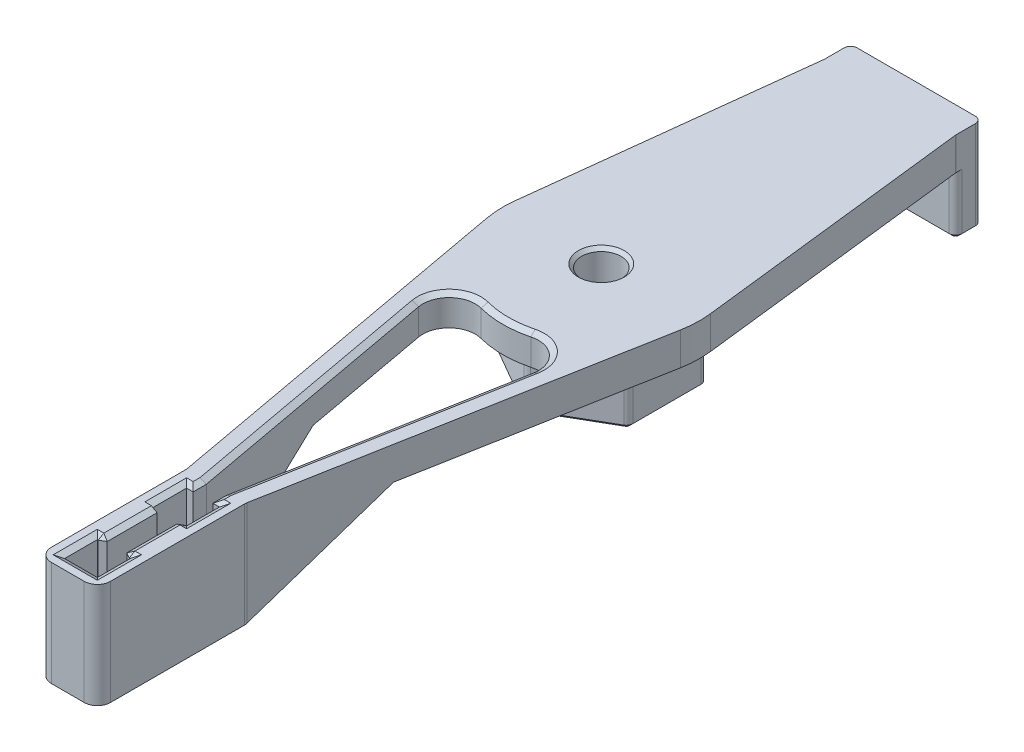
from build123d import *
from OCP.BRepFilletAPI import BRepFilletAPI_MakeChamfer

# Parameters (mm, degrees)
SKETCH1_R           = 15
BOSS_EXTRUDE1_DEPTH = 5
BOSS_EXTRUDE2_DEPTH = 9
CUT_EXTRUDE1_REACH  = 27.417
SKETCH3_R           = 3
FILLET1_R           = 1
CHAMFER1_SIZE       = 0.5
BOSS_EXTRUDE3_START = -5
BOSS_EXTRUDE3_DEPTH = 5
SKETCH5_W           = 20
SKETCH5_H           = 4
BOSS_EXTRUDE4_DEPTH = 9
FILLET2_R           = 1
CHAMFER3_SIZE       = 0.5
FILLET3_R           = 1
BOSS_EXTRUDE5_START = -5
BOSS_EXTRUDE5_DEPTH = 5
SKETCH7_W           = 9
SKETCH7_H           = 22.6
BOSS_EXTRUDE6_DEPTH = 11
SKETCH8_W           = 5
SKETCH8_H           = 18.6
CUT_EXTRUDE2_DEPTH  = 3
CUT_EXTRUDE4_REACH  = 85.688
SKETCH10_W          = 5
SKETCH10_H          = 5
CUT_EXTRUDE5_DEPTH  = 16
CHAMFER5_SIZE       = 19.052558883
CHAMFER5_SIZE_2     = 11
FILLET4_R           = 4
CHAMFER6_SIZE       = 0.5
CHAMFER6_SIZE2      = 0.866025404
FILLET5_R           = 2


with BuildPart() as part:
    # Sketch1 → Boss-Extrude1 (new body)
    with BuildSketch(Plane(origin=(0, 0, 0), x_dir=(1, 0, 0), z_dir=(0, 1, 0))):
        with Locations(Location((0, 0, 0), (0, 0, 270))):
            Circle(SKETCH1_R)
    extrude(amount=BOSS_EXTRUDE1_DEPTH)

    # Sketch2 → Boss-Extrude2 (add)
    with BuildSketch(Plane.XZ):
        Polygon((0, 11.547005384), (-10, 5.773502692), (-10, -5.773502692), (0, -11.547005384), (10, -5.773502692), (10, 5.773502692), align=None)
    extrude(amount=BOSS_EXTRUDE2_DEPTH)

    # Sketch3 → Cut-Extrude1 (cut, up to next)
    with BuildSketch(Plane(origin=(0, 5, 0), x_dir=(1, 0, 0), z_dir=(0, 1, 0)), mode=Mode.PRIVATE) as cut_extrude1_sk1:
        with Locations(Location((0, 0, 0), (0, 0, 270))):
            Circle(SKETCH3_R)
    cut_extrude1_tool1 = extrude(cut_extrude1_sk1.sketch, amount=-CUT_EXTRUDE1_REACH, mode=Mode.PRIVATE) & part.part
    add(cut_extrude1_tool1.solids().sort_by_distance((0, 5, 0))[0], mode=Mode.SUBTRACT)

    # Fillet1
    fillet1_edges = [part.edges().sort_by_distance(p)[0] for p in [
        (10, -4.5, 5.773502692),
        (0, -4.5, 11.547005384),
        (-10, -4.5, 5.773502692),
        (-10, -4.5, -5.773502692),
        (0, -4.5, -11.547005384),
        (10, -4.5, -5.773502692),
    ]]
    fillet(fillet1_edges, radius=FILLET1_R)

    # Chamfer1
    chamfer1_edges = [part.edges().sort_by_distance(p)[0] for p in [
        (0, -9, -3),
        (0, 5, -3),
        (-5, 0, -8.660254038),
        (-5, -9, -8.660254038),
        (-10, 0, 0),
        (-10, -9, 0),
        (5, -9, 8.660254038),
        (-5, -9, 8.660254038),
        (5, -9, -8.660254038),
        (10, -9, 0),
        (-9.866025404, -9, 5.696152423),
        (0, -9, 11.392304845),
        (9.866025404, -9, 5.696152423),
        (9.866025404, -9, -5.696152423),
        (0, -9, -11.392304845),
        (-9.866025404, -9, -5.696152423),
        (5, 0, -8.660254038),
        (10, 0, 0),
        (5, 0, 8.660254038),
        (-5, 0, 8.660254038),
        (-9.866025404, 0, -5.696152423),
        (0, 0, -11.392304845),
        (9.866025404, 0, -5.696152423),
        (9.866025404, 0, 5.696152423),
        (0, 0, 11.392304845),
        (-9.866025404, 0, 5.696152423),
    ]]
    chamfer(chamfer1_edges, length=CHAMFER1_SIZE)

    # Sketch4 → Boss-Extrude3 (add)
    with BuildSketch(Plane(origin=(0, 5, 0), x_dir=(1, 0, 0), z_dir=(0, 1, 0)).offset(BOSS_EXTRUDE3_START)):
        with BuildLine():
            Line((10, 48), (-10, 48))
            Line((-10, 48), (-10, 44))
            Line((-10, 44), (-14.900225018, 1.727221587))
            ThreePointArc((-14.900225018, 1.727221587), (0, 15), (14.900225018, 1.727221587))
            Line((14.900225018, 1.727221587), (10, 44))
            Line((10, 44), (10, 48))
        make_face()
    extrude(amount=BOSS_EXTRUDE3_DEPTH)

    # Sketch5 → Boss-Extrude4 (add)
    with BuildSketch(Plane.XZ):
        with Locations((0, -46)):
            Rectangle(SKETCH5_W, SKETCH5_H)
    extrude(amount=BOSS_EXTRUDE4_DEPTH)

    # Fillet2
    fillet2_edges = [part.edges().sort_by_distance(p)[0] for p in [
        (-10, -2, -48),
        (10, -2, -48),
        (-10, -4.5, -44),
        (10, -4.5, -44),
    ]]
    fillet(fillet2_edges, radius=FILLET2_R)

    # Chamfer3
    chamfer3_edges = [part.edges().sort_by_distance(p)[0] for p in [
        (-10, -9, -46),
        (0, -9, -44),
        (0, -9, -48),
        (10, -9, -46),
        (-9.707106781, -9, -47.707106781),
        (9.707106781, -9, -47.707106781),
        (9.707106781, -9, -44.292893219),
        (-9.707106781, -9, -44.292893219),
    ]]
    chamfer(chamfer3_edges, length=CHAMFER3_SIZE)

    # Fillet3
    fillet3_edges = [part.edges().sort_by_distance(p)[0] for p in [
        (-10, 2.5, -44),
        (10, 2.5, -44),
    ]]
    fillet(fillet3_edges, radius=FILLET3_R)

    # Sketch6 → Boss-Extrude5 (add)
    with BuildSketch(Plane(origin=(0, 5, 0), x_dir=(1, 0, 0), z_dir=(0, 1, 0)).offset(BOSS_EXTRUDE5_START)):
        with BuildLine():
            Line((4.5, -58.7), (4.5, -81.3))
            Line((4.5, -81.3), (-4.5, -81.3))
            Line((-4.5, -81.3), (-4.5, -58.7))
            Line((-4.5, -58.7), (-14.754643314, -2.701943869))
            ThreePointArc((-14.754643314, -2.701943869), (0, -15), (14.754643314, -2.701943869))
            Line((14.754643314, -2.701943869), (4.5, -58.7))
        make_face()
    extrude(amount=BOSS_EXTRUDE5_DEPTH)

    # Sketch7 → Boss-Extrude6 (add)
    with BuildSketch(Plane.XZ):
        with Locations((0, 70)):
            Rectangle(SKETCH7_W, SKETCH7_H)
    extrude(amount=BOSS_EXTRUDE6_DEPTH)

    # Sketch8 → Cut-Extrude2 (cut)
    with BuildSketch(Plane.XZ.offset(11)):
        with Locations((0, 70)):
            Rectangle(SKETCH8_W, SKETCH8_H)
    extrude(amount=-CUT_EXTRUDE2_DEPTH, mode=Mode.SUBTRACT)

    # Sketch10 → Cut-Extrude4 (cut, up to next)
    with BuildSketch(Plane.XZ.offset(8), mode=Mode.PRIVATE) as cut_extrude4_sk1:
        with Locations((0, 76.8)):
            Rectangle(SKETCH10_W, SKETCH10_H)
    cut_extrude4_tool1 = extrude(cut_extrude4_sk1.sketch, amount=-CUT_EXTRUDE4_REACH, mode=Mode.PRIVATE) & part.part
    # Sketch10 → Cut-Extrude4 (cut, up to next)
    with BuildSketch(Plane.XZ.offset(8), mode=Mode.PRIVATE) as cut_extrude4_sk2:
        with Locations((0, 63.2)):
            Rectangle(SKETCH10_W, SKETCH10_H)
    cut_extrude4_tool2 = extrude(cut_extrude4_sk2.sketch, amount=-CUT_EXTRUDE4_REACH, mode=Mode.PRIVATE) & part.part
    add(cut_extrude4_tool1.solids().sort_by_distance((0, -8, 76.8))[0], mode=Mode.SUBTRACT)
    add(cut_extrude4_tool2.solids().sort_by_distance((0, -8, 63.2))[0], mode=Mode.SUBTRACT)

    # Sketch11 → Cut-Extrude5 (cut)
    with BuildSketch(Plane.XZ.offset(11)):
        with BuildLine():
            Line((-1.5, 74.3), (-1.5, 58.7))
            Line((-1.5, 58.7), (-10.24267003, 10.958453844))
            ThreePointArc((-10.24267003, 10.958453844), (0, 15), (10.24267003, 10.958453844))
            Line((10.24267003, 10.958453844), (1.5, 58.7))
            Line((1.5, 58.7), (1.5, 74.3))
            Line((1.5, 74.3), (-1.5, 74.3))
        make_face()
    extrude(amount=-CUT_EXTRUDE5_DEPTH, mode=Mode.SUBTRACT)

    # Chamfer5
    # the kernel refuses this chamfer: 19.052558883, 11 mm, written as the material it adds along each edge
    with BuildSketch(Plane(origin=(47.790603676, 0, 58.7), x_dir=(0, 0.01932676561270063, -0.9998132206222079), z_dir=(-1, 0, 0))) as chamfer5_piece_1_section:
        Polygon((CHAMFER5_SIZE * 0.999813220636, CHAMFER5_SIZE * 0.019326765613), (-CHAMFER5_SIZE_2 * 0.0193267656127, CHAMFER5_SIZE_2 * 0.999813220622), (0, 0), align=None)
    chamfer5_piece_1 = extrude(amount=101.581207353, mode=Mode.PRIVATE)
    chamfer5_piece_1 = split(chamfer5_piece_1, bisect_by=Plane(origin=(6.212258684, -2.756527894, 49.349781279), z_dir=(-0.9836428876173074, 0, -0.18012959123887753)), keep=Keep.TOP, mode=Mode.PRIVATE)
    chamfer5_piece_1 = split(chamfer5_piece_1, bisect_by=Plane(origin=(3.309598693, -2.756527894, 48.818231705), z_dir=(0.9836428876173074, 0, 0.18012959123887784)), keep=Keep.TOP, mode=Mode.PRIVATE)
    add(chamfer5_piece_1)
    with BuildSketch(Plane(origin=(47.790603676, 0, 58.7), x_dir=(0, 0.01932676561270063, -0.9998132206222079), z_dir=(-1, 0, 0))) as chamfer5_piece_2_section:
        Polygon((CHAMFER5_SIZE * 0.999813220636, CHAMFER5_SIZE * 0.019326765613), (-CHAMFER5_SIZE_2 * 0.0193267656127, CHAMFER5_SIZE_2 * 0.999813220622), (0, 0), align=None)
    chamfer5_piece_2 = extrude(amount=101.581207353, mode=Mode.PRIVATE)
    chamfer5_piece_2 = split(chamfer5_piece_2, bisect_by=Plane(origin=(-2.334821756, -4.240286921, 54.141246068), z_dir=(-0.9836428876173074, 0, 0.18012959123887784)), keep=Keep.TOP, mode=Mode.PRIVATE)
    chamfer5_piece_2 = split(chamfer5_piece_2, bisect_by=Plane(origin=(-5.237481747, -4.240286921, 54.672795642), z_dir=(0.9836428876173074, 0, -0.18012959123887773)), keep=Keep.TOP, mode=Mode.PRIVATE)
    add(chamfer5_piece_2)
    with BuildSketch(Plane(origin=(53.790603676, 0, 58.7), x_dir=(0, 0.01932676561270063, -0.9998132206222079), z_dir=(-1, 0, 0))) as chamfer5_piece_3_section:
        Polygon((CHAMFER5_SIZE * 0.999813220636, CHAMFER5_SIZE * 0.019326765613), (-CHAMFER5_SIZE_2 * 0.0193267656127, CHAMFER5_SIZE_2 * 0.999813220622), (0, 0), align=None)
    chamfer5_piece_3 = extrude(amount=101.581207353, mode=Mode.PRIVATE)
    chamfer5_piece_3 = split(chamfer5_piece_3, bisect_by=Plane(origin=(6.212258684, -2.756527894, 49.349781279), z_dir=(-0.9836428876173074, 0, -0.18012959123887753)), keep=Keep.TOP, mode=Mode.PRIVATE)
    chamfer5_piece_3 = split(chamfer5_piece_3, bisect_by=Plane(origin=(3.309598693, -2.756527894, 48.818231705), z_dir=(0.9836428876173074, 0, 0.18012959123887784)), keep=Keep.TOP, mode=Mode.PRIVATE)
    add(chamfer5_piece_3)
    with BuildSketch(Plane(origin=(53.790603676, 0, 58.7), x_dir=(0, 0.01932676561270063, -0.9998132206222079), z_dir=(-1, 0, 0))) as chamfer5_piece_4_section:
        Polygon((CHAMFER5_SIZE * 0.999813220636, CHAMFER5_SIZE * 0.019326765613), (-CHAMFER5_SIZE_2 * 0.0193267656127, CHAMFER5_SIZE_2 * 0.999813220622), (0, 0), align=None)
    chamfer5_piece_4 = extrude(amount=101.581207353, mode=Mode.PRIVATE)
    chamfer5_piece_4 = split(chamfer5_piece_4, bisect_by=Plane(origin=(-2.334821756, -4.240286921, 54.141246068), z_dir=(-0.9836428876173074, 0, 0.18012959123887784)), keep=Keep.TOP, mode=Mode.PRIVATE)
    chamfer5_piece_4 = split(chamfer5_piece_4, bisect_by=Plane(origin=(-5.237481747, -4.240286921, 54.672795642), z_dir=(0.9836428876173074, 0, -0.18012959123887773)), keep=Keep.TOP, mode=Mode.PRIVATE)
    add(chamfer5_piece_4)

    # Fillet4
    fillet4_edges = [part.edges().sort_by_distance(p)[0] for p in [
        (10.24267003, 2.5, 10.958453844),
        (-10.24267003, 2.5, 10.958453844),
    ]]
    fillet(fillet4_edges, radius=FILLET4_R)

    # Chamfer6: one chamfer whose edges measure the first distance from different faces: ONE call of the kernel's chamfer builder (chamfer() names one face for all edges)
    chamfer6_edges_1 = [part.edges().sort_by_distance(p)[0] for p in [
        (0, -11, 79.3),
        (-2.5, -11, 70),
        (-2, -11, 60.7),
        (2.5, -11, 70),
        (2, -11, 60.7),
        (-1.5, -11, 59.7),
        (1.5, -11, 59.7),
    ]]
    chamfer6_side_1 = [part.faces().sort_by_distance(p)[0] for p in [
        (-4.256738823, -11, 70),
    ]]
    chamfer6_edges_2 = [part.edges().sort_by_distance(p)[0] for p in [
        (-2.5, 5, 76.8),
        (-2.5, 5, 63.2),
    ]]
    chamfer6_side_2 = [part.faces().sort_by_distance(p)[0] for p in [
        (-2.5, -3, 79.054651269),
    ]]
    chamfer6_edges_3 = [part.edges().sort_by_distance(p)[0] for p in [
        (0, 5, 79.3),
    ]]
    chamfer6_side_3 = [part.faces().sort_by_distance(p)[0] for p in [
        (0, -3, 79.3),
    ]]
    chamfer6_edges_4 = [part.edges().sort_by_distance(p)[0] for p in [
        (2.5, 5, 76.8),
        (2.5, 5, 63.2),
    ]]
    chamfer6_side_4 = [part.faces().sort_by_distance(p)[0] for p in [
        (2.5, -1.5, 74.545348731),
    ]]
    chamfer6_edges_5 = [part.edges().sort_by_distance(p)[0] for p in [
        (-2, 5, 74.3),
    ]]
    chamfer6_side_5 = [part.faces().sort_by_distance(p)[0] for p in [
        (-2, -1.5, 74.3),
    ]]
    chamfer6_edges_6 = [part.edges().sort_by_distance(p)[0] for p in [
        (-2, 5, 60.7),
    ]]
    chamfer6_side_6 = [part.faces().sort_by_distance(p)[0] for p in [
        (-2, -3, 60.7),
    ]]
    chamfer6_edges_7 = [part.edges().sort_by_distance(p)[0] for p in [
        (2, 5, 65.7),
    ]]
    chamfer6_side_7 = [part.faces().sort_by_distance(p)[0] for p in [
        (2, -1.5, 65.7),
    ]]
    chamfer6_edges_8 = [part.edges().sort_by_distance(p)[0] for p in [
        (2, 5, 74.3),
    ]]
    chamfer6_side_8 = [part.faces().sort_by_distance(p)[0] for p in [
        (2, -1.5, 74.3),
    ]]
    chamfer6_edges_9 = [part.edges().sort_by_distance(p)[0] for p in [
        (-2, 5, 65.7),
    ]]
    chamfer6_side_9 = [part.faces().sort_by_distance(p)[0] for p in [
        (6.431537391, 5, 39.138943683),
    ]]
    chamfer6_edges_10 = [part.edges().sort_by_distance(p)[0] for p in [
        (2, 5, 60.7),
    ]]
    chamfer6_side_10 = [part.faces().sort_by_distance(p)[0] for p in [
        (2, -3, 60.7),
    ]]
    chamfer6_edges_11 = [part.edges().sort_by_distance(p)[0] for p in [
        (-5.125902347, 5, 38.899849283),
        (-6.870402149, 0, 29.373569841),
    ]]
    chamfer6_side_11 = [part.faces().sort_by_distance(p)[0] for p in [
        (-4.273546673, 0.365854061, 43.554351583),
    ]]
    chamfer6_edges_12 = [part.edges().sort_by_distance(p)[0] for p in [
        (-1.5, 5, 59.7),
    ]]
    chamfer6_side_12 = [part.faces().sort_by_distance(p)[0] for p in [
        (-1.5, -3, 59.7),
    ]]
    chamfer6_edges_13 = [part.edges().sort_by_distance(p)[0] for p in [
        (1.5, 5, 59.7),
    ]]
    chamfer6_side_13 = [part.faces().sort_by_distance(p)[0] for p in [
        (1.5, -3, 59.7),
    ]]
    chamfer6_edges_14 = [part.edges().sort_by_distance(p)[0] for p in [
        (-1.5, 5, 70),
        (-1.5, -1.5, 65.7),
        (-1.5, -1.5, 74.3),
    ]]
    chamfer6_side_14 = [part.faces().sort_by_distance(p)[0] for p in [
        (-1.5, -1.5, 70),
    ]]
    chamfer6_edges_15 = [part.edges().sort_by_distance(p)[0] for p in [
        (1.5, -1.5, 65.7),
        (1.5, 5, 70),
        (1.5, -1.5, 74.3),
    ]]
    chamfer6_side_15 = [part.faces().sort_by_distance(p)[0] for p in [
        (1.5, -1.5, 70),
    ]]
    chamfer6_edges_16 = [part.edges().sort_by_distance(p)[0] for p in [
        (6.870402149, 0, 29.373569841),
        (5.125902347, 5, 38.899849283),
    ]]
    chamfer6_side_16 = [part.faces().sort_by_distance(p)[0] for p in [
        (4.273546673, 0.365854061, 43.554351583),
    ]]
    chamfer6_edges_17 = [part.edges().sort_by_distance(p)[0] for p in [
        (0, 5, 15),
        (0, 0, 15),
    ]]
    chamfer6_side_17 = [part.faces().sort_by_distance(p)[0] for p in [
        (0, 2.5, 15),
    ]]
    chamfer6_edges_18 = [part.edges().sort_by_distance(p)[0] for p in [
        (7.537310318, 0, 15.44640333),
        (7.537310318, 5, 15.44640333),
    ]]
    chamfer6_side_18 = [part.faces().sort_by_distance(p)[0] for p in [
        (7.537310318, 2.5, 15.44640333),
    ]]
    chamfer6_edges_19 = [part.edges().sort_by_distance(p)[0] for p in [
        (-7.537310318, 0, 15.44640333),
        (-7.537310318, 5, 15.44640333),
    ]]
    chamfer6_side_19 = [part.faces().sort_by_distance(p)[0] for p in [
        (-7.537310318, 2.5, 15.44640333),
    ]]
    chamfer6 = BRepFilletAPI_MakeChamfer(part.part.solid().wrapped)
    for e in chamfer6_edges_1:
        chamfer6.Add(CHAMFER6_SIZE, CHAMFER6_SIZE2, e.wrapped, chamfer6_side_1[0].wrapped)  # the first distance lies on this face
    for e in chamfer6_edges_2:
        chamfer6.Add(CHAMFER6_SIZE, CHAMFER6_SIZE2, e.wrapped, chamfer6_side_2[0].wrapped)  # the first distance lies on this face
    for e in chamfer6_edges_3:
        chamfer6.Add(CHAMFER6_SIZE, CHAMFER6_SIZE2, e.wrapped, chamfer6_side_3[0].wrapped)  # the first distance lies on this face
    for e in chamfer6_edges_4:
        chamfer6.Add(CHAMFER6_SIZE, CHAMFER6_SIZE2, e.wrapped, chamfer6_side_4[0].wrapped)  # the first distance lies on this face
    for e in chamfer6_edges_5:
        chamfer6.Add(CHAMFER6_SIZE, CHAMFER6_SIZE2, e.wrapped, chamfer6_side_5[0].wrapped)  # the first distance lies on this face
    for e in chamfer6_edges_6:
        chamfer6.Add(CHAMFER6_SIZE, CHAMFER6_SIZE2, e.wrapped, chamfer6_side_6[0].wrapped)  # the first distance lies on this face
    for e in chamfer6_edges_7:
        chamfer6.Add(CHAMFER6_SIZE, CHAMFER6_SIZE2, e.wrapped, chamfer6_side_7[0].wrapped)  # the first distance lies on this face
    for e in chamfer6_edges_8:
        chamfer6.Add(CHAMFER6_SIZE, CHAMFER6_SIZE2, e.wrapped, chamfer6_side_8[0].wrapped)  # the first distance lies on this face
    for e in chamfer6_edges_9:
        chamfer6.Add(CHAMFER6_SIZE, CHAMFER6_SIZE2, e.wrapped, chamfer6_side_9[0].wrapped)  # the first distance lies on this face
    for e in chamfer6_edges_10:
        chamfer6.Add(CHAMFER6_SIZE, CHAMFER6_SIZE2, e.wrapped, chamfer6_side_10[0].wrapped)  # the first distance lies on this face
    for e in chamfer6_edges_11:
        chamfer6.Add(CHAMFER6_SIZE, CHAMFER6_SIZE2, e.wrapped, chamfer6_side_11[0].wrapped)  # the first distance lies on this face
    for e in chamfer6_edges_12:
        chamfer6.Add(CHAMFER6_SIZE, CHAMFER6_SIZE2, e.wrapped, chamfer6_side_12[0].wrapped)  # the first distance lies on this face
    for e in chamfer6_edges_13:
        chamfer6.Add(CHAMFER6_SIZE, CHAMFER6_SIZE2, e.wrapped, chamfer6_side_13[0].wrapped)  # the first distance lies on this face
    for e in chamfer6_edges_14:
        chamfer6.Add(CHAMFER6_SIZE, CHAMFER6_SIZE2, e.wrapped, chamfer6_side_14[0].wrapped)  # the first distance lies on this face
    for e in chamfer6_edges_15:
        chamfer6.Add(CHAMFER6_SIZE, CHAMFER6_SIZE2, e.wrapped, chamfer6_side_15[0].wrapped)  # the first distance lies on this face
    for e in chamfer6_edges_16:
        chamfer6.Add(CHAMFER6_SIZE, CHAMFER6_SIZE2, e.wrapped, chamfer6_side_16[0].wrapped)  # the first distance lies on this face
    for e in chamfer6_edges_17:
        chamfer6.Add(CHAMFER6_SIZE, CHAMFER6_SIZE2, e.wrapped, chamfer6_side_17[0].wrapped)  # the first distance lies on this face
    for e in chamfer6_edges_18:
        chamfer6.Add(CHAMFER6_SIZE, CHAMFER6_SIZE2, e.wrapped, chamfer6_side_18[0].wrapped)  # the first distance lies on this face
    for e in chamfer6_edges_19:
        chamfer6.Add(CHAMFER6_SIZE, CHAMFER6_SIZE2, e.wrapped, chamfer6_side_19[0].wrapped)  # the first distance lies on this face
    add(Compound.cast(chamfer6.Shape()), mode=Mode.REPLACE)

    # Fillet5
    fillet5_edges = [part.edges().sort_by_distance(p)[0] for p in [
        (4.5, -3, 81.3),
        (-4.5, -3, 81.3),
        (-4.5, -3, 58.7),
        (4.5, -3, 58.7),
    ]]
    fillet(fillet5_edges, radius=FILLET5_R)


solid = part.part
